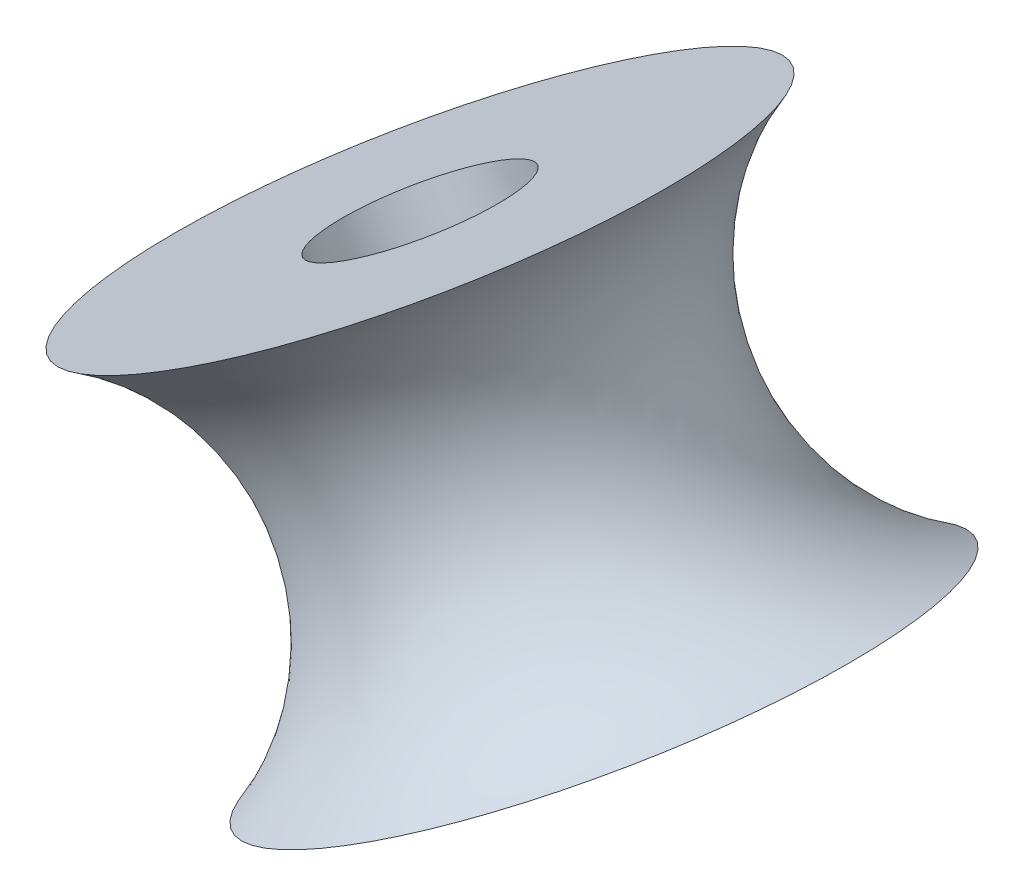
from build123d import *


with BuildPart() as part:
    # Sketch1 → Revolve2 (revolve)
    with BuildSketch(Plane.XY):
        with BuildLine():
            Line((-0.42333395, 5.93323591), (4.92666605, -3.33323591))
            Line((4.92666605, -3.33323591), (9.797119576, -0.521278256))
            ThreePointArc((9.797119576, -0.521278256), (4.58512091, 2.647220792), (4.447119576, 8.745193564))
            Line((4.447119576, 8.745193564), (-0.42333395, 5.93323591))
        make_face()
    revolve(axis=Axis((-2.675, 4.63323591, 0), (0.5000000000000001, -0.8660254037844387, 0)))


solid = part.part
